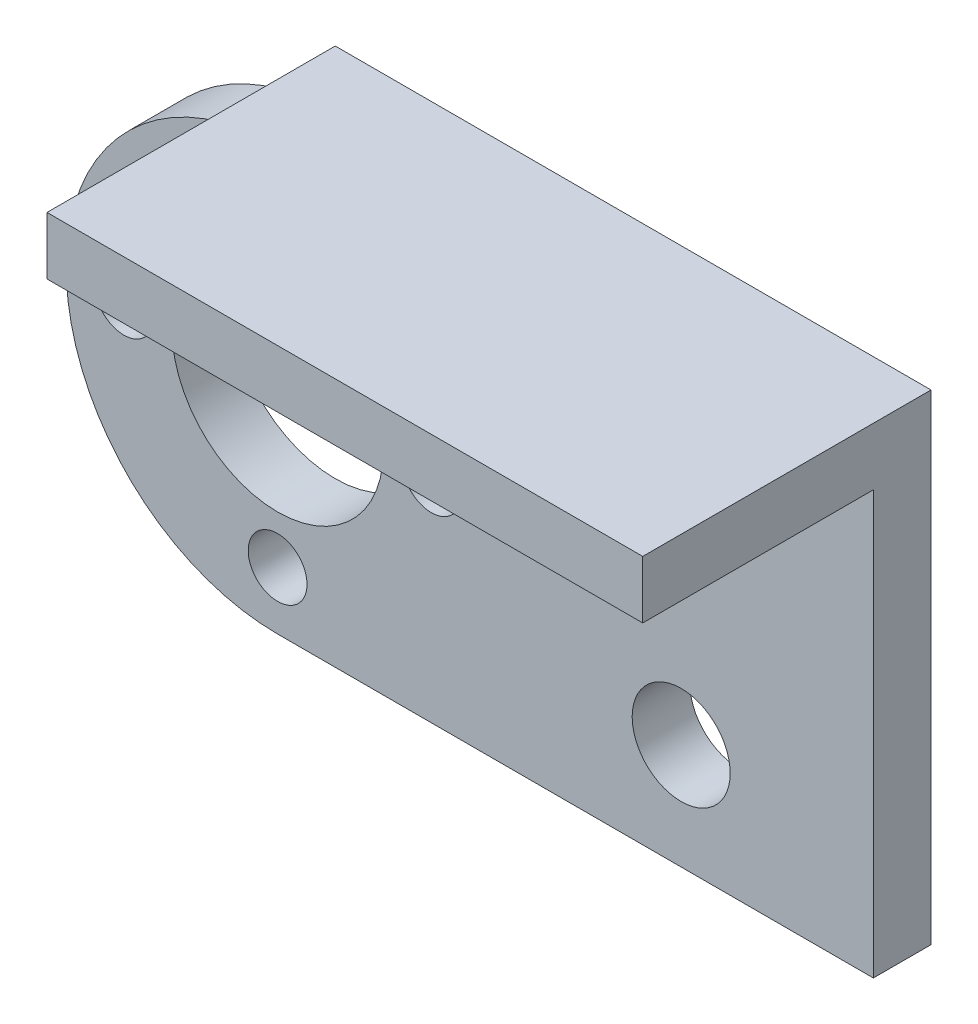
from build123d import *

# Parameters (mm, degrees)
SKETCH1_R           = 1.53
SKETCH1_R_2         = 5.5
BOSS_EXTRUDE1_DEPTH = 3
SKETCH2_R           = 2.55
CUT_EXTRUDE1_DEPTH  = 10
SKETCH4_W           = 31
SKETCH4_H           = 3
BOSS_EXTRUDE2_DEPTH = 15
FILLET1_R           = 4
FILLET4_R           = 1


with BuildPart() as part:
    # Sketch1 → Boss-Extrude1 (new body)
    with BuildSketch(Plane.XY):
        with BuildLine():
            Line((0, -11), (11, -11))
            Line((11, -11), (31, -11))
            Line((31, -11), (31, 11))
            Line((31, 11), (11, 11))
            Line((11, 11), (0, 11))
            ThreePointArc((0, 11), (-11, 0), (0, -11))
        make_face()
        with Locations((0, 8)):
            Circle(SKETCH1_R, mode=Mode.SUBTRACT)
        with Locations((8, 0)):
            Circle(SKETCH1_R, mode=Mode.SUBTRACT)
        with Locations((0, -8)):
            Circle(SKETCH1_R, mode=Mode.SUBTRACT)
        with Locations((-8, 0)):
            Circle(SKETCH1_R, mode=Mode.SUBTRACT)
        Circle(SKETCH1_R_2, mode=Mode.SUBTRACT)
    extrude(amount=BOSS_EXTRUDE1_DEPTH)

    # Sketch2 → Cut-Extrude1 (cut)
    with BuildSketch(Plane.XY):
        with Locations((21, 5.5)):
            Circle(SKETCH2_R)
        with Locations(Location((21, -5.5, 0), (0, 0, 180))):
            Circle(SKETCH2_R)
    extrude(amount=CUT_EXTRUDE1_DEPTH, mode=Mode.SUBTRACT)

    # Sketch4 → Boss-Extrude2 (add)
    with BuildSketch(Plane.XY):
        with Locations((15.5, 12.5)):
            Rectangle(SKETCH4_W, SKETCH4_H)
    extrude(amount=BOSS_EXTRUDE2_DEPTH)

    # Fillet1
    # the kernel refuses this fillet: 4 mm, written as the material it adds along each edge
    with BuildSketch(Plane(origin=(0, 11, 0), x_dir=(0, 1, 0), z_dir=(0, 0, 1))) as fillet1_piece_1:
        with BuildLine():
            CenterArc((3.464285714, 3.972963475), FILLET1_R, 195.358885581, 67.975687163)
            ThreePointArc((-0.392857143, 2.913506549), (-0.098656701, 1.469936831), (0, 0))
            Line((0, 0), (3, 0))
        make_face()
    extrude(amount=3)

    # Fillet4
    # the kernel refuses this fillet: 1 mm, written as the material it adds along each edge
    with BuildSketch(Plane(origin=(0, 11, 3), x_dir=(-1, 0, 0), z_dir=(0, 1, 0))) as fillet4_piece_1_section:
        with BuildLine():
            CenterArc((FILLET4_R, FILLET4_R), FILLET4_R, 180, 90)
            Line((0, FILLET4_R), (0, 0))
            Line((0, 0), (FILLET4_R, 0))
        make_face()
    fillet4_piece_1 = extrude(amount=3, mode=Mode.PRIVATE)
    fillet4_piece_1 = fillet4_piece_1 - Plane(origin=(-3.972963475, 14.464285714, 3.249866194), x_dir=(0, 1, 0), z_dir=(0, 0, -1)) * Cylinder(4, 10, mode=Mode.PRIVATE)
    add(fillet4_piece_1)


solid = part.part
